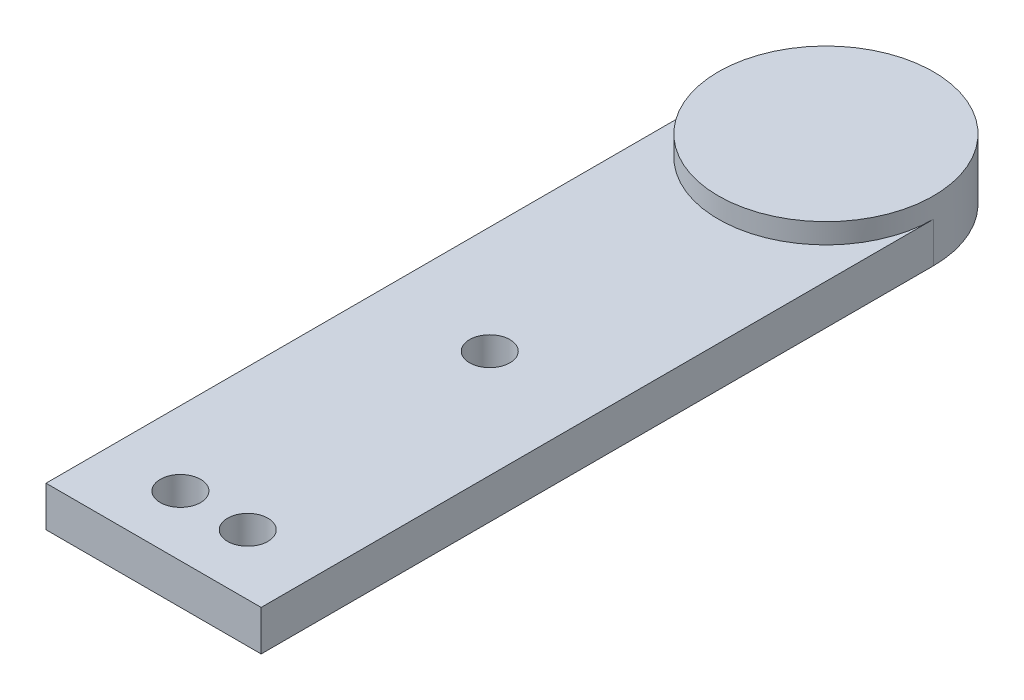
from build123d import *

# Parameters (mm, degrees)
BOSS_EXTRUDE1_DEPTH      = 3
BOSS_EXTRUDE1_DEPTH_BACK = 1.5
SKETCH1_R                = 8
SKETCH2_W                = 16
SKETCH2_H                = 50
BOSS_EXTRUDE2_DEPTH      = 1.5
CUT_EXTRUDE1_REACH       = 52.836
SKETCH3_R                = 1.5
CUT_EXTRUDE3_REACH       = 52.725
SKETCH5_R                = 1.5


with BuildPart() as part:
    # Sketch1 → Boss-Extrude1 (new, two sides: drawn at the far end of the back side and taken through both)
    with BuildSketch(Plane(origin=(0, 0, 0), x_dir=(1, 0, 0), z_dir=(0, 1, 0)).offset(-BOSS_EXTRUDE1_DEPTH_BACK)):
        Circle(SKETCH1_R)
    extrude(amount=BOSS_EXTRUDE1_DEPTH + BOSS_EXTRUDE1_DEPTH_BACK)

    # Sketch2 → Boss-Extrude2 (add, symmetric)
    with BuildSketch(Plane(origin=(0, 0, 0), x_dir=(1, 0, 0), z_dir=(0, 1, 0))):
        with Locations((0, -25)):
            Rectangle(SKETCH2_W, SKETCH2_H)
    extrude(amount=BOSS_EXTRUDE2_DEPTH, both=True)

    # Sketch3 → Cut-Extrude1 (cut, up to next)
    with BuildSketch(Plane(origin=(0, -1.5, 0), x_dir=(-1, 0, 0), z_dir=(0, -1, 0)), mode=Mode.PRIVATE) as cut_extrude1_sk1:
        with Locations((2.503073418, -45.5)):
            Circle(SKETCH3_R)
    cut_extrude1_tool1 = extrude(cut_extrude1_sk1.sketch, amount=-CUT_EXTRUDE1_REACH, mode=Mode.PRIVATE) & part.part
    # Sketch3 → Cut-Extrude1 (cut, up to next)
    with BuildSketch(Plane(origin=(0, -1.5, 0), x_dir=(-1, 0, 0), z_dir=(0, -1, 0)), mode=Mode.PRIVATE) as cut_extrude1_sk2:
        with Locations((-2.503073418, -45.5)):
            Circle(SKETCH3_R)
    cut_extrude1_tool2 = extrude(cut_extrude1_sk2.sketch, amount=-CUT_EXTRUDE1_REACH, mode=Mode.PRIVATE) & part.part
    add(cut_extrude1_tool1.solids().sort_by_distance((-2.503073, -1.5, 45.5))[0], mode=Mode.SUBTRACT)
    add(cut_extrude1_tool2.solids().sort_by_distance((2.503073, -1.5, 45.5))[0], mode=Mode.SUBTRACT)

    # Sketch4 → Cut-Revolve21 (revolve, cut)
    with BuildSketch(Plane(origin=(0, -1.5, 0), x_dir=(-1, 0, 0), z_dir=(0, -1, 0))):
        with BuildLine():
            Line((3.3, 0), (-3.3, 0))
            ThreePointArc((-3.3, 0), (0, -3.3), (3.3, 0))
        make_face()
    revolve(axis=Axis((3.3, -1.5, 0), (-1, 0, 0)), mode=Mode.SUBTRACT)

    # Sketch5 → Cut-Extrude3 (cut, up to next)
    with BuildSketch(Plane(origin=(0, 1.5, 0), x_dir=(1, 0, 0), z_dir=(0, 1, 0)), mode=Mode.PRIVATE) as cut_extrude3_sk1:
        with Locations((0, -25)):
            Circle(SKETCH5_R)
    cut_extrude3_tool1 = extrude(cut_extrude3_sk1.sketch, amount=-CUT_EXTRUDE3_REACH, mode=Mode.PRIVATE) & part.part
    add(cut_extrude3_tool1.solids().sort_by_distance((0, 1.5, 25))[0], mode=Mode.SUBTRACT)


solid = part.part
